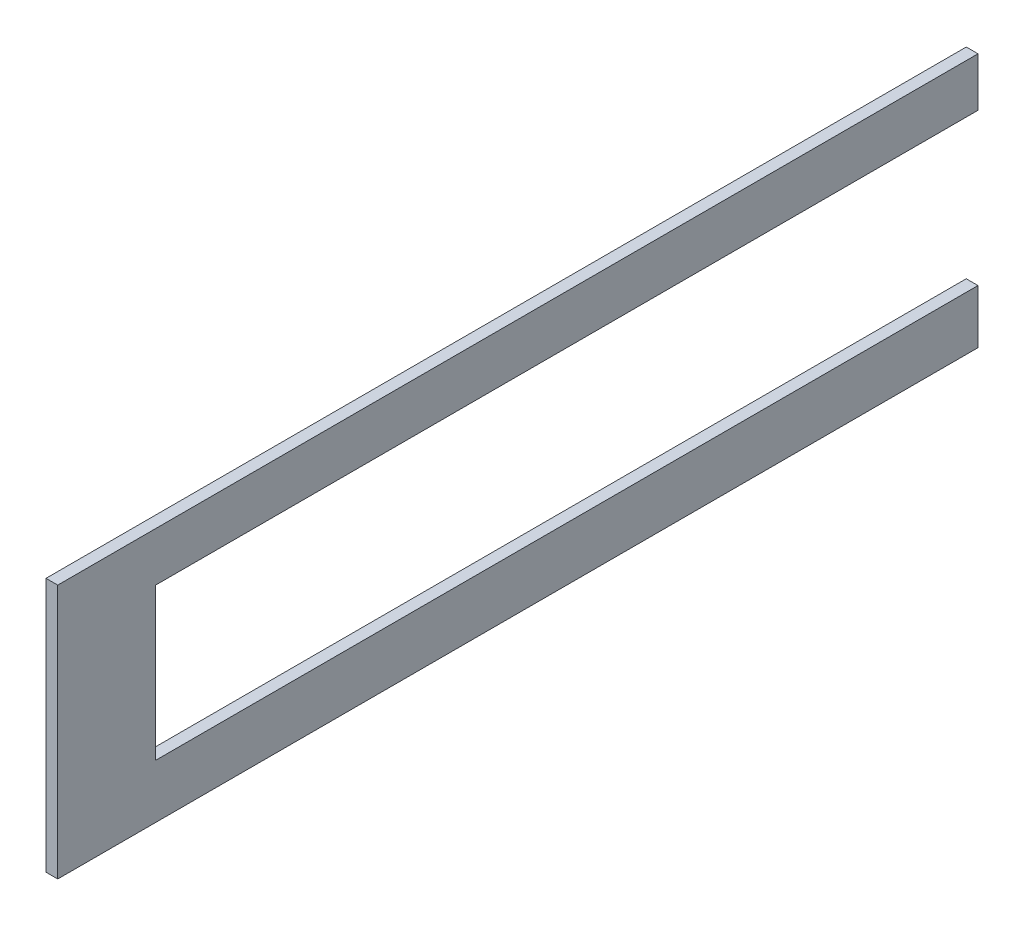
from build123d import *

# Parameters (mm, degrees)
BOSS_EXTRUDE1_DEPTH = 6


with BuildPart() as part:
    # Sketch1 → Boss-Extrude1 (new body)
    with BuildSketch(Plane(origin=(0, 0, 0), x_dir=(0, 0, -1), z_dir=(1, 0, 0))):
        Polygon((470, 105), (470, 130), (0, 130), (0, 0), (470, 0), (470, 27.5), (50, 27.5), (50, 105), align=None)
    extrude(amount=BOSS_EXTRUDE1_DEPTH)


solid = part.part
